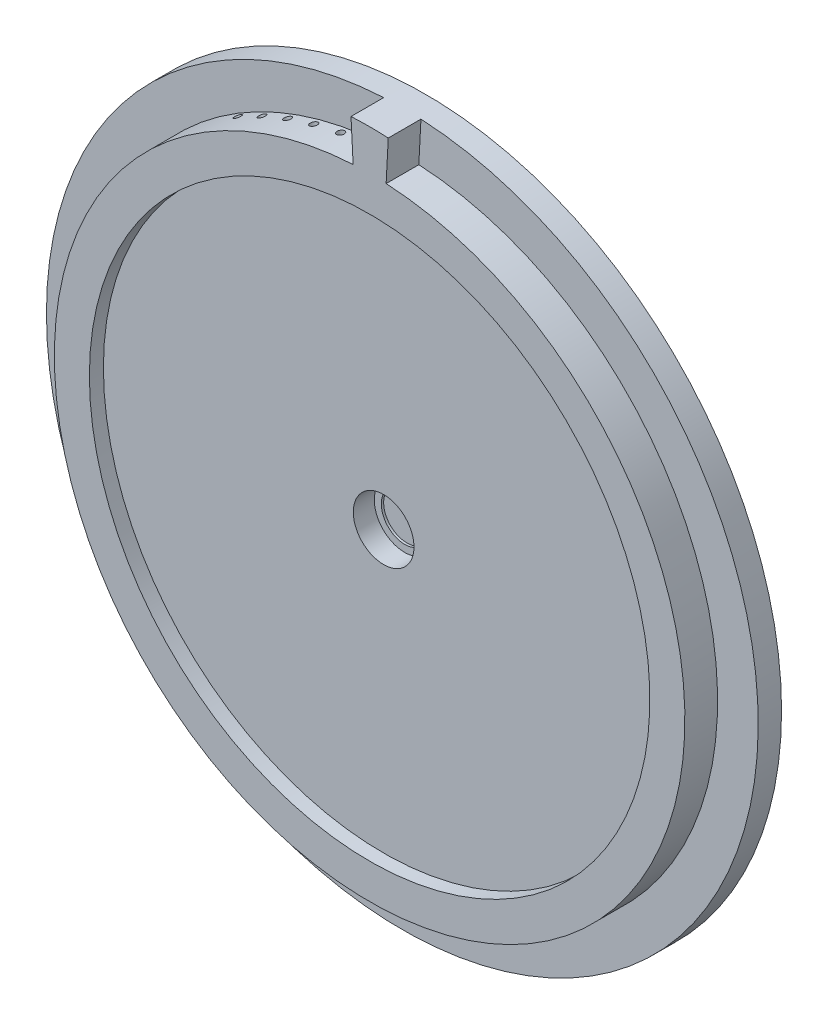
from build123d import *
from build123d.topology import SkipClean

# Parameters (mm, degrees)
SKETCH1_3_W              = 17.39
SKETCH1_3_H              = 14
REVOLVE2_ANGLE           = 3
REVOLVE2_OTHER_WAY_ANGLE = 3
CIRPATTERN1_COUNT        = 6
CIRPATTERN1_ANGLE        = 25


with BuildPart() as part:
    # Sketch1 → Revolve1 (revolve)
    with BuildSketch(Plane.YZ, mode=Mode.PRIVATE) as revolve1_sk:
        Polygon((120, 13), (13, 13), (13, 4), (10, 4), (10, 3), (0, 3), (0, 0), (19, 0), (19, 10), (129, 10), (129, -5), (152.39, -5), (152.39, 5), (135, 5), (135, 19), (120, 19), align=None)
    revolve(revolve1_sk.sketch.rotate(Axis((0, 0, 0), (0, 0, 1)), 90), axis=Axis((0, 0, 0), (0, 0, 1)))

    # Sketch1<3> → Revolve2 (revolve)
    with BuildSketch(Plane.YZ):
        with Locations((143.695, 12)):
            Rectangle(SKETCH1_3_W, SKETCH1_3_H)
    revolve(axis=Axis((0, 0, 0), (0, 0, 1)), revolution_arc=REVOLVE2_ANGLE)

    # Sketch1<3> → Revolve2 other way (revolve)
    with SkipClean():  # the faces are left unmerged after this step: merging them gives an invalid solid
        with BuildSketch(Plane.YZ):
            with Locations((143.695, 12)):
                Rectangle(SKETCH1_3_W, SKETCH1_3_H)
        revolve(axis=Axis((0, 0, 0), (0, 0, -1)), revolution_arc=REVOLVE2_OTHER_WAY_ANGLE)
    add(part.part.scale(1), mode=Mode.REPLACE)  # the faces are merged on a copy

    # Sketch2 → Cut-Revolve4 (revolve, cut)
    with BuildSketch(Plane(origin=(0, 0, 8), x_dir=(0, 1, 0), z_dir=(0, 0, 1)), mode=Mode.PRIVATE) as cut_revolve4_sk:
        Polygon((111.823962377, 11.376893011), (151.671750301, 14.863122721), (151.810110042, 13.281663637), (111.962322119, 9.795433927), align=None)
    cut_revolve4 = revolve(cut_revolve4_sk.sketch.rotate(Axis((-9.795433927, 111.962322119, 8), (-0.08715574274765829, 0.9961946980917455, 0)), 180), axis=Axis((-9.795433927, 111.962322119, 8), (-0.08715574274765829, 0.9961946980917455, 0)), mode=Mode.SUBTRACT)

    # CirPattern1: Cut-Revolve4 ×6 about axis
    cirpattern1_axis = Axis((0, 0, 0), (0, 0, 1))
    for i in range(1, CIRPATTERN1_COUNT):
        add(cut_revolve4.rotate(cirpattern1_axis, i * CIRPATTERN1_ANGLE / (CIRPATTERN1_COUNT - 1)), mode=Mode.SUBTRACT)


solid = part.part
